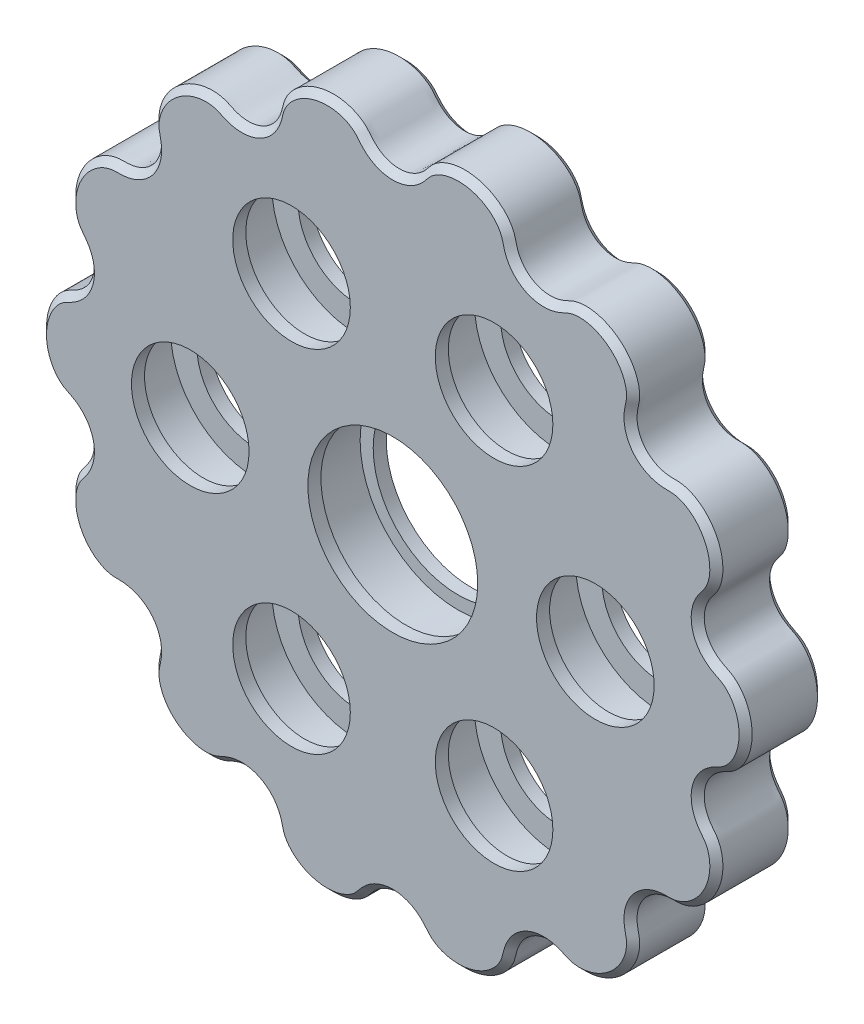
from build123d import *

# Parameters (mm, degrees)
LOBEBASE_DEPTH      = 3
LOBEBASE_DEPTH_BACK = 3
BOREREVOLVESKETCH_W = 6
BOREREVOLVESKETCH_H = 7.5
SKETCH1_R           = 6.5
CUT_EXTRUDE1_DEPTH  = 39.259605541
SKETCH2_R           = 7.5
SKETCH2_R_2         = 6.5
BOSS_EXTRUDE1_DEPTH = 1
BOSS_EXTRUDE2_START = -5
SKETCH2_2_R         = 7.5
SKETCH2_2_R_2       = 6.5
BOSS_EXTRUDE2_DEPTH = 1
SKETCH3_R           = 6.5
SKETCH3_R_2         = 4.5
BOSS_EXTRUDE3_DEPTH = 1
BOSS_EXTRUDE4_START = -5
SKETCH3_2_R         = 6.5
SKETCH3_2_R_2       = 4.5
BOSS_EXTRUDE4_DEPTH = 1
CHAMFER1_SIZE       = 0.5


with BuildPart() as part:
    # LobeBaseSketch → LobeBase (new, two sides: drawn at the far end of the back side and taken through both)
    with BuildSketch(Plane.XY.offset(-LOBEBASE_DEPTH_BACK)):
        with BuildLine():
            add(Edge.make_bspline(
                [(27, 0), (27, 0.121069856), (26.990222559, 0.362149228), (26.946659636, 0.718772486), (26.875703391, 1.064531007), (26.779762989, 1.394454994), (26.662084286, 1.704114682), (26.526623862, 1.989775884), (26.377887527, 2.248535855), (26.220731626, 2.47843636), (26.060121888, 2.678552425), (25.900837152, 2.849058104), (25.747089803, 2.991275915), (25.60200158, 3.107728779), (25.466797299, 3.20224233), (25.339394472, 3.280230369), (25.211573238, 3.349556807), (25.062548838, 3.423396592), (24.843299997, 3.530576201), (24.451170363, 3.751663149), (23.825065297, 4.28054647), (23.28812949, 5.315363587), (23.322901616, 6.480669309), (23.657528916, 7.228833523), (23.914899477, 7.598164652), (24.065932368, 7.78985865), (24.16816083, 7.921045261), (24.253244169, 8.038965778), (24.334192407, 8.164508589), (24.414999362, 8.308325295), (24.49519233, 8.47619712), (24.57200791, 8.671039415), (24.641538857, 8.893770781), (24.699416124, 9.143755079), (24.741258607, 9.419075666), (24.76299367, 9.716744622), (24.761095545, 10.032890547), (24.732764089, 10.362943161), (24.676054752, 10.701821383), (24.58996512, 11.044125807), (24.474480925, 11.384333503), (24.330583391, 11.716991422), (24.160219602, 12.036903864), (23.966237733, 12.339309072), (23.752289365, 12.620039975), (23.522701396, 12.875664235), (23.282320245, 13.103599098), (23.036330869, 13.302196873), (22.790052318, 13.470797274), (22.548709654, 13.609743082), (22.317178173, 13.720355473), (22.099687943, 13.804864724), (21.899460373, 13.866290069), (21.718213397, 13.908259054), (21.555390656, 13.934749882), (21.406766933, 13.949736663), (21.261524366, 13.95673807), (21.09522014, 13.958606154), (20.85118027, 13.960043137), (20.401957646, 13.989096923), (19.6083826, 14.193947523), (18.675629834, 14.893317813), (18.201351234, 15.958309051), (18.178223727, 16.77757106), (18.249859818, 17.22199581), (18.302762842, 17.46023685), (18.337947767, 17.62278717), (18.363441411, 17.765946162), (18.38190227, 17.914178451), (18.392307091, 18.078813649), (18.391721602, 18.264855362), (18.376391145, 18.473731235), (18.342396846, 18.704573608), (18.286078339, 18.954913684), (18.204319989, 19.221123734), (18.094748885, 19.498744687), (17.955868156, 19.782758757), (17.787137935, 20.06783333), (17.589010837, 20.348546798), (17.362926435, 20.619599536), (17.111268183, 20.876009365), (16.837286124, 21.113288993), (16.544988847, 21.327602066), (16.23900852, 21.515894166), (15.924443127, 21.675995251), (15.606680305, 21.806690265), (15.29120714, 21.907755008), (14.983410026, 21.97995463), (14.688367746, 22.025002084), (14.410639193, 22.045473273), (14.154043619, 22.04467385), (13.921424502, 22.02644858), (13.714374237, 21.994915417), (13.532866694, 21.95408805), (13.374674534, 21.907309322), (13.234266666, 21.856326528), (13.100369839, 21.79961619), (12.949724376, 21.729142576), (12.729228568, 21.624552322), (12.311887003, 21.455818487), (11.508019249, 21.296063191), (10.364192648, 21.521467792), (9.474800014, 22.275209969), (9.098498387, 23.003304885), (8.970211602, 23.434799484), (8.914506667, 23.672401006), (8.875679248, 23.834119951), (8.836533869, 23.974163024), (8.788850949, 24.115725567), (8.726792833, 24.268571238), (8.645544852, 24.435934996), (8.541104742, 24.617474018), (8.410318185, 24.810706236), (8.250958476, 25.011819166), (8.061792535, 25.216192516), (7.842617165, 25.418779231), (7.594260866, 25.614408976), (7.318550967, 25.798042992), (7.018247611, 25.964992962), (6.696947228, 26.111108695), (6.358958923, 26.232935544), (6.009157844, 26.327840742), (5.65282014, 26.394107113), (5.295444511, 26.430992544), (4.942565628, 26.438753829), (4.599564776, 26.418633847), (4.271482927, 26.372811358), (3.962841068, 26.304312807), (3.677471801, 26.216885113), (3.418364905, 26.114827113), (3.187527138, 26.002774211), (2.985852204, 25.885424158), (2.812988087, 25.767178016), (2.667169773, 25.651640658), (2.544940091, 25.540857475), (2.440557578, 25.434002874), (2.344526399, 25.324812969), (2.239376882, 25.19595582), (2.086097034, 25.006053711), (1.783296144, 24.672952061), (1.128351548, 24.180232366), (0, 23.887027132), (-1.128351548, 24.180232366), (-1.783296144, 24.672952061), (-2.086097034, 25.006053711), (-2.239376882, 25.19595582), (-2.344526399, 25.324812969), (-2.440557578, 25.434002874), (-2.544940091, 25.540857475), (-2.667169773, 25.651640658), (-2.812988087, 25.767178016), (-2.985852204, 25.885424158), (-3.187527138, 26.002774211), (-3.418364905, 26.114827113), (-3.677471801, 26.216885113), (-3.962841068, 26.304312807), (-4.271482927, 26.372811358), (-4.599564776, 26.418633847), (-4.942565628, 26.438753829), (-5.295444511, 26.430992544), (-5.65282014, 26.394107113), (-6.009157844, 26.327840742), (-6.358958923, 26.232935544), (-6.696947228, 26.111108695), (-7.018247611, 25.964992962), (-7.318550967, 25.798042992), (-7.594260866, 25.614408976), (-7.842617165, 25.418779231), (-8.061792535, 25.216192516), (-8.250958476, 25.011819166), (-8.410318185, 24.810706236), (-8.541104742, 24.617474018), (-8.645544852, 24.435934996), (-8.726792833, 24.268571238), (-8.788850949, 24.115725567), (-8.836533869, 23.974163024), (-8.875679248, 23.834119951), (-8.914506667, 23.672401006), (-8.970211602, 23.434799484), (-9.098498387, 23.003304885), (-9.474800014, 22.275209969), (-10.364192648, 21.521467792), (-11.508019249, 21.296063191), (-12.311887003, 21.455818487), (-12.729228568, 21.624552322), (-12.949724376, 21.729142576), (-13.100369839, 21.79961619), (-13.234266666, 21.856326528), (-13.374674534, 21.907309322), (-13.532866694, 21.95408805), (-13.714374237, 21.994915417), (-13.921424502, 22.02644858), (-14.154043619, 22.04467385), (-14.410639193, 22.045473273), (-14.688367746, 22.025002084), (-14.983410026, 21.97995463), (-15.29120714, 21.907755008), (-15.606680305, 21.806690265), (-15.924443127, 21.675995251), (-16.23900852, 21.515894166), (-16.544988847, 21.327602066), (-16.837286124, 21.113288993), (-17.111268183, 20.876009365), (-17.362926435, 20.619599536), (-17.589010837, 20.348546798), (-17.787137935, 20.06783333), (-17.955868156, 19.782758757), (-18.094748885, 19.498744687), (-18.204319989, 19.221123734), (-18.286078339, 18.954913684), (-18.342396846, 18.704573608), (-18.376391145, 18.473731235), (-18.391721602, 18.264855362), (-18.392307091, 18.078813649), (-18.38190227, 17.914178451), (-18.363441411, 17.765946162), (-18.337947767, 17.62278717), (-18.302762842, 17.46023685), (-18.249859818, 17.22199581), (-18.178223727, 16.77757106), (-18.201351234, 15.958309051), (-18.675629834, 14.893317813), (-19.6083826, 14.193947523), (-20.401957646, 13.989096923), (-20.85118027, 13.960043137), (-21.09522014, 13.958606154), (-21.261524366, 13.95673807), (-21.406766933, 13.949736663), (-21.555390656, 13.934749882), (-21.718213397, 13.908259054), (-21.899460373, 13.866290069), (-22.099687943, 13.804864724), (-22.317178173, 13.720355473), (-22.548709654, 13.609743082), (-22.790052318, 13.470797274), (-23.036330869, 13.302196873), (-23.282320245, 13.103599098), (-23.522701396, 12.875664235), (-23.752289365, 12.620039975), (-23.966237733, 12.339309072), (-24.160219602, 12.036903864), (-24.330583391, 11.716991422), (-24.474480925, 11.384333503), (-24.58996512, 11.044125807), (-24.676054752, 10.701821383), (-24.732764089, 10.362943161), (-24.761095545, 10.032890547), (-24.76299367, 9.716744622), (-24.741258607, 9.419075666), (-24.699416124, 9.143755079), (-24.641538857, 8.893770781), (-24.57200791, 8.671039415), (-24.49519233, 8.47619712), (-24.414999362, 8.308325295), (-24.334192407, 8.164508589), (-24.253244169, 8.038965778), (-24.16816083, 7.921045261), (-24.065932368, 7.78985865), (-23.914899477, 7.598164652), (-23.657528916, 7.228833523), (-23.322901616, 6.480669309), (-23.28812949, 5.315363587), (-23.825065297, 4.28054647), (-24.451170363, 3.751663149), (-24.843299997, 3.530576201), (-25.062548838, 3.423396592), (-25.211573238, 3.349556807), (-25.339394472, 3.280230369), (-25.466797299, 3.20224233), (-25.60200158, 3.107728779), (-25.747089803, 2.991275915), (-25.900837152, 2.849058104), (-26.060121888, 2.678552425), (-26.220731626, 2.47843636), (-26.377887527, 2.248535855), (-26.526623862, 1.989775884), (-26.662084286, 1.704114682), (-26.779762989, 1.394454994), (-26.875703391, 1.064531007), (-26.946659636, 0.718772486), (-26.990222559, 0.362149228), (-27.004910223, 0), (-26.990222559, -0.362149228), (-26.946659636, -0.718772486), (-26.875703391, -1.064531007), (-26.779762989, -1.394454994), (-26.662084286, -1.704114682), (-26.526623862, -1.989775884), (-26.377887527, -2.248535855), (-26.220731626, -2.47843636), (-26.060121888, -2.678552425), (-25.900837152, -2.849058104), (-25.747089803, -2.991275915), (-25.60200158, -3.107728779), (-25.466797299, -3.20224233), (-25.339394472, -3.280230369), (-25.211573238, -3.349556807), (-25.062548838, -3.423396592), (-24.843299997, -3.530576201), (-24.451170363, -3.751663149), (-23.825065297, -4.28054647), (-23.28812949, -5.315363587), (-23.322901616, -6.480669309), (-23.657528916, -7.228833523), (-23.914899477, -7.598164652), (-24.065932368, -7.78985865), (-24.16816083, -7.921045261), (-24.253244169, -8.038965778), (-24.334192407, -8.164508589), (-24.414999362, -8.308325295), (-24.49519233, -8.47619712), (-24.57200791, -8.671039415), (-24.641538857, -8.893770781), (-24.699416124, -9.143755079), (-24.741258607, -9.419075666), (-24.76299367, -9.716744622), (-24.761095545, -10.032890547), (-24.732764089, -10.362943161), (-24.676054752, -10.701821383), (-24.58996512, -11.044125807), (-24.474480925, -11.384333503), (-24.330583391, -11.716991422), (-24.160219602, -12.036903864), (-23.966237733, -12.339309072), (-23.752289365, -12.620039975), (-23.522701396, -12.875664235), (-23.282320245, -13.103599098), (-23.036330869, -13.302196873), (-22.790052318, -13.470797274), (-22.548709654, -13.609743082), (-22.317178173, -13.720355473), (-22.099687943, -13.804864724), (-21.899460373, -13.866290069), (-21.718213397, -13.908259054), (-21.555390656, -13.934749882), (-21.406766933, -13.949736663), (-21.261524366, -13.95673807), (-21.09522014, -13.958606154), (-20.85118027, -13.960043137), (-20.401957646, -13.989096923), (-19.6083826, -14.193947523), (-18.675629834, -14.893317813), (-18.201351234, -15.958309051), (-18.178223727, -16.77757106), (-18.249859818, -17.22199581), (-18.302762842, -17.46023685), (-18.337947767, -17.62278717), (-18.363441411, -17.765946162), (-18.38190227, -17.914178451), (-18.392307091, -18.078813649), (-18.391721602, -18.264855362), (-18.376391145, -18.473731235), (-18.342396846, -18.704573608), (-18.286078339, -18.954913684), (-18.204319989, -19.221123734), (-18.094748885, -19.498744687), (-17.955868156, -19.782758757), (-17.787137935, -20.06783333), (-17.589010837, -20.348546798), (-17.362926435, -20.619599536), (-17.111268183, -20.876009365), (-16.837286124, -21.113288993), (-16.544988847, -21.327602066), (-16.23900852, -21.515894166), (-15.924443127, -21.675995251), (-15.606680305, -21.806690265), (-15.29120714, -21.907755008), (-14.983410026, -21.97995463), (-14.688367746, -22.025002084), (-14.410639193, -22.045473273), (-14.154043619, -22.04467385), (-13.921424502, -22.02644858), (-13.714374237, -21.994915417), (-13.532866694, -21.95408805), (-13.374674534, -21.907309322), (-13.234266666, -21.856326528), (-13.100369839, -21.79961619), (-12.949724376, -21.729142576), (-12.729228568, -21.624552322), (-12.311887003, -21.455818487), (-11.508019249, -21.296063191), (-10.364192648, -21.521467792), (-9.474800014, -22.275209969), (-9.098498387, -23.003304885), (-8.970211602, -23.434799484), (-8.914506667, -23.672401006), (-8.875679248, -23.834119951), (-8.836533869, -23.974163024), (-8.788850949, -24.115725567), (-8.726792833, -24.268571238), (-8.645544852, -24.435934996), (-8.541104742, -24.617474018), (-8.410318185, -24.810706236), (-8.250958476, -25.011819166), (-8.061792535, -25.216192516), (-7.842617165, -25.418779231), (-7.594260866, -25.614408976), (-7.318550967, -25.798042992), (-7.018247611, -25.964992962), (-6.696947228, -26.111108695), (-6.358958923, -26.232935544), (-6.009157844, -26.327840742), (-5.65282014, -26.394107113), (-5.295444511, -26.430992544), (-4.942565628, -26.438753829), (-4.599564776, -26.418633847), (-4.271482927, -26.372811358), (-3.962841068, -26.304312807), (-3.677471801, -26.216885113), (-3.418364905, -26.114827113), (-3.187527138, -26.002774211), (-2.985852204, -25.885424158), (-2.812988087, -25.767178016), (-2.667169773, -25.651640658), (-2.544940091, -25.540857475), (-2.440557578, -25.434002874), (-2.344526399, -25.324812969), (-2.239376882, -25.19595582), (-2.086097034, -25.006053711), (-1.783296144, -24.672952061), (-1.128351548, -24.180232366), (0, -23.887027132), (1.128351548, -24.180232366), (1.783296144, -24.672952061), (2.086097034, -25.006053711), (2.239376882, -25.19595582), (2.344526399, -25.324812969), (2.440557578, -25.434002874), (2.544940091, -25.540857475), (2.667169773, -25.651640658), (2.812988087, -25.767178016), (2.985852204, -25.885424158), (3.187527138, -26.002774211), (3.418364905, -26.114827113), (3.677471801, -26.216885113), (3.962841068, -26.304312807), (4.271482927, -26.372811358), (4.599564776, -26.418633847), (4.942565628, -26.438753829), (5.295444511, -26.430992544), (5.65282014, -26.394107113), (6.009157844, -26.327840742), (6.358958923, -26.232935544), (6.696947228, -26.111108695), (7.018247611, -25.964992962), (7.318550967, -25.798042992), (7.594260866, -25.614408976), (7.842617165, -25.418779231), (8.061792535, -25.216192516), (8.250958476, -25.011819166), (8.410318185, -24.810706236), (8.541104742, -24.617474018), (8.645544852, -24.435934996), (8.726792833, -24.268571238), (8.788850949, -24.115725567), (8.836533869, -23.974163024), (8.875679248, -23.834119951), (8.914506667, -23.672401006), (8.970211602, -23.434799484), (9.098498387, -23.003304885), (9.474800014, -22.275209969), (10.364192648, -21.521467792), (11.508019249, -21.296063191), (12.311887003, -21.455818487), (12.729228568, -21.624552322), (12.949724376, -21.729142576), (13.100369839, -21.79961619), (13.234266666, -21.856326528), (13.374674534, -21.907309322), (13.532866694, -21.95408805), (13.714374237, -21.994915417), (13.921424502, -22.02644858), (14.154043619, -22.04467385), (14.410639193, -22.045473273), (14.688367746, -22.025002084), (14.983410026, -21.97995463), (15.29120714, -21.907755008), (15.606680305, -21.806690265), (15.924443127, -21.675995251), (16.23900852, -21.515894166), (16.544988847, -21.327602066), (16.837286124, -21.113288993), (17.111268183, -20.876009365), (17.362926435, -20.619599536), (17.589010837, -20.348546798), (17.787137935, -20.06783333), (17.955868156, -19.782758757), (18.094748885, -19.498744687), (18.204319989, -19.221123734), (18.286078339, -18.954913684), (18.342396846, -18.704573608), (18.376391145, -18.473731235), (18.391721602, -18.264855362), (18.392307091, -18.078813649), (18.38190227, -17.914178451), (18.363441411, -17.765946162), (18.337947767, -17.62278717), (18.302762842, -17.46023685), (18.249859818, -17.22199581), (18.178223727, -16.77757106), (18.201351234, -15.958309051), (18.675629834, -14.893317813), (19.6083826, -14.193947523), (20.401957646, -13.989096923), (20.85118027, -13.960043137), (21.09522014, -13.958606154), (21.261524366, -13.95673807), (21.406766933, -13.949736663), (21.555390656, -13.934749882), (21.718213397, -13.908259054), (21.899460373, -13.866290069), (22.099687943, -13.804864724), (22.317178173, -13.720355473), (22.548709654, -13.609743082), (22.790052318, -13.470797274), (23.036330869, -13.302196873), (23.282320245, -13.103599098), (23.522701396, -12.875664235), (23.752289365, -12.620039975), (23.966237733, -12.339309072), (24.160219602, -12.036903864), (24.330583391, -11.716991422), (24.474480925, -11.384333503), (24.58996512, -11.044125807), (24.676054752, -10.701821383), (24.732764089, -10.362943161), (24.761095545, -10.032890547), (24.76299367, -9.716744622), (24.741258607, -9.419075666), (24.699416124, -9.143755079), (24.641538857, -8.893770781), (24.57200791, -8.671039415), (24.49519233, -8.47619712), (24.414999362, -8.308325295), (24.334192407, -8.164508589), (24.253244169, -8.038965778), (24.16816083, -7.921045261), (24.065932368, -7.78985865), (23.914899477, -7.598164652), (23.657528916, -7.228833523), (23.322901616, -6.480669309), (23.28812949, -5.315363587), (23.825065297, -4.28054647), (24.451170363, -3.751663149), (24.843299997, -3.530576201), (25.062548838, -3.423396592), (25.211573238, -3.349556807), (25.339394472, -3.280230369), (25.466797299, -3.20224233), (25.60200158, -3.107728779), (25.747089803, -2.991275915), (25.900837152, -2.849058104), (26.060121888, -2.678552425), (26.220731626, -2.47843636), (26.377887527, -2.248535855), (26.526623862, -1.989775884), (26.662084286, -1.704114682), (26.779762989, -1.394454994), (26.875703391, -1.064531007), (26.946659636, -0.718772486), (26.990222559, -0.362149228), (27, -0.121069856), (27, 0)],
                knots=[0, 0, 0, 0, 0.001915682, 0.003814585, 0.00568012, 0.007496075, 0.009246828, 0.010917582, 0.012494651, 0.013965812, 0.015320796, 0.016551974, 0.017655442, 0.018632789, 0.019494234, 0.020264608, 0.020995763, 0.021794924, 0.022896741, 0.024858367, 0.028909602, 0.035714286, 0.042518969, 0.046570204, 0.048531831, 0.049633648, 0.050432808, 0.051163963, 0.051934338, 0.052795782, 0.053773129, 0.054876597, 0.056107776, 0.057462759, 0.058933921, 0.060510989, 0.062181744, 0.063932496, 0.065748451, 0.067613986, 0.06951289, 0.071428571, 0.073344253, 0.075243157, 0.077108692, 0.078924647, 0.080675399, 0.082346153, 0.083923222, 0.085394384, 0.086749367, 0.087980546, 0.089084014, 0.09006136, 0.090922805, 0.091693179, 0.092424334, 0.093223495, 0.094325312, 0.096286939, 0.100338173, 0.107142857, 0.113947541, 0.117998776, 0.119960402, 0.121062219, 0.12186138, 0.122592535, 0.123362909, 0.124224354, 0.1252017, 0.126305169, 0.127536347, 0.12889133, 0.130362492, 0.131939561, 0.133610315, 0.135361068, 0.137177023, 0.139042557, 0.140941461, 0.142857143, 0.144772824, 0.146671728, 0.148537263, 0.150353218, 0.152103971, 0.153774725, 0.155351794, 0.156822955, 0.158177938, 0.159409117, 0.160512585, 0.161489932, 0.162351376, 0.163121751, 0.163852906, 0.164652067, 0.165753883, 0.16771551, 0.171766745, 0.178571429, 0.185376112, 0.189427347, 0.191388974, 0.19249079, 0.193289951, 0.194021106, 0.194791481, 0.195652925, 0.196630272, 0.19773374, 0.198964919, 0.200319902, 0.201791064, 0.203368132, 0.205038887, 0.206789639, 0.208605594, 0.210471129, 0.212370033, 0.214285714, 0.216201396, 0.2181003, 0.219965835, 0.221781789, 0.223532542, 0.225203296, 0.226780365, 0.228251527, 0.22960651, 0.230837688, 0.231941157, 0.232918503, 0.233779948, 0.234550322, 0.235281477, 0.236080638, 0.237182455, 0.239144082, 0.243195316, 0.25, 0.256804684, 0.260855918, 0.262817545, 0.263919362, 0.264718523, 0.265449678, 0.266220052, 0.267081497, 0.268058843, 0.269162312, 0.27039349, 0.271748473, 0.273219635, 0.274796704, 0.276467458, 0.278218211, 0.280034165, 0.2818997, 0.283798604, 0.285714286, 0.287629967, 0.289528871, 0.291394406, 0.293210361, 0.294961113, 0.296631868, 0.298208936, 0.299680098, 0.301035081, 0.30226626, 0.303369728, 0.304347075, 0.305208519, 0.305978894, 0.306710049, 0.30750921, 0.308611026, 0.310572653, 0.314623888, 0.321428571, 0.328233255, 0.33228449, 0.334246117, 0.335347933, 0.336147094, 0.336878249, 0.337648624, 0.338510068, 0.339487415, 0.340590883, 0.341822062, 0.343177045, 0.344648206, 0.346225275, 0.347896029, 0.349646782, 0.351462737, 0.353328272, 0.355227176, 0.357142857, 0.359058539, 0.360957443, 0.362822977, 0.364638932, 0.366389685, 0.368060439, 0.369637508, 0.37110867, 0.372463653, 0.373694831, 0.3747983, 0.375775646, 0.376637091, 0.377407465, 0.37813862, 0.378937781, 0.380039598, 0.382001224, 0.386052459, 0.392857143, 0.399661827, 0.403713061, 0.405674688, 0.406776505, 0.407575666, 0.408306821, 0.409077195, 0.40993864, 0.410915986, 0.412019454, 0.413250633, 0.414605616, 0.416076778, 0.417653847, 0.419324601, 0.421075353, 0.422891308, 0.424756843, 0.426655747, 0.428571429, 0.43048711, 0.432386014, 0.434251549, 0.436067504, 0.437818256, 0.439489011, 0.441066079, 0.442537241, 0.443892224, 0.445123403, 0.446226871, 0.447204218, 0.448065662, 0.448836037, 0.449567192, 0.450366352, 0.451468169, 0.453429796, 0.457481031, 0.464285714, 0.471090398, 0.475141633, 0.477103259, 0.478205076, 0.479004237, 0.479735392, 0.480505766, 0.481367211, 0.482344558, 0.483448026, 0.484679204, 0.486034188, 0.487505349, 0.489082418, 0.490753172, 0.492503925, 0.49431988, 0.496185415, 0.498084318, 0.5, 0.501915682, 0.503814585, 0.50568012, 0.507496075, 0.509246828, 0.510917582, 0.512494651, 0.513965812, 0.515320796, 0.516551974, 0.517655442, 0.518632789, 0.519494234, 0.520264608, 0.520995763, 0.521794924, 0.522896741, 0.524858367, 0.528909602, 0.535714286, 0.542518969, 0.546570204, 0.548531831, 0.549633648, 0.550432808, 0.551163963, 0.551934338, 0.552795782, 0.553773129, 0.554876597, 0.556107776, 0.557462759, 0.558933921, 0.560510989, 0.562181744, 0.563932496, 0.565748451, 0.567613986, 0.56951289, 0.571428571, 0.573344253, 0.575243157, 0.577108692, 0.578924647, 0.580675399, 0.582346153, 0.583923222, 0.585394384, 0.586749367, 0.587980546, 0.589084014, 0.59006136, 0.590922805, 0.591693179, 0.592424334, 0.593223495, 0.594325312, 0.596286939, 0.600338173, 0.607142857, 0.613947541, 0.617998776, 0.619960402, 0.621062219, 0.62186138, 0.622592535, 0.623362909, 0.624224354, 0.6252017, 0.626305169, 0.627536347, 0.62889133, 0.630362492, 0.631939561, 0.633610315, 0.635361068, 0.637177023, 0.639042557, 0.640941461, 0.642857143, 0.644772824, 0.646671728, 0.648537263, 0.650353218, 0.652103971, 0.653774725, 0.655351794, 0.656822955, 0.658177938, 0.659409117, 0.660512585, 0.661489932, 0.662351376, 0.663121751, 0.663852906, 0.664652067, 0.665753883, 0.66771551, 0.671766745, 0.678571429, 0.685376112, 0.689427347, 0.691388974, 0.69249079, 0.693289951, 0.694021106, 0.694791481, 0.695652925, 0.696630272, 0.69773374, 0.698964919, 0.700319902, 0.701791064, 0.703368132, 0.705038887, 0.706789639, 0.708605594, 0.710471129, 0.712370033, 0.714285714, 0.716201396, 0.7181003, 0.719965835, 0.721781789, 0.723532542, 0.725203296, 0.726780365, 0.728251527, 0.72960651, 0.730837688, 0.731941157, 0.732918503, 0.733779948, 0.734550322, 0.735281477, 0.736080638, 0.737182455, 0.739144082, 0.743195316, 0.75, 0.756804684, 0.760855918, 0.762817545, 0.763919362, 0.764718523, 0.765449678, 0.766220052, 0.767081497, 0.768058843, 0.769162312, 0.77039349, 0.771748473, 0.773219635, 0.774796704, 0.776467458, 0.778218211, 0.780034165, 0.7818997, 0.783798604, 0.785714286, 0.787629967, 0.789528871, 0.791394406, 0.793210361, 0.794961113, 0.796631868, 0.798208936, 0.799680098, 0.801035081, 0.80226626, 0.803369728, 0.804347075, 0.805208519, 0.805978894, 0.806710049, 0.80750921, 0.808611026, 0.810572653, 0.814623888, 0.821428571, 0.828233255, 0.83228449, 0.834246117, 0.835347933, 0.836147094, 0.836878249, 0.837648624, 0.838510068, 0.839487415, 0.840590883, 0.841822062, 0.843177045, 0.844648206, 0.846225275, 0.847896029, 0.849646782, 0.851462737, 0.853328272, 0.855227176, 0.857142857, 0.859058539, 0.860957443, 0.862822977, 0.864638932, 0.866389685, 0.868060439, 0.869637508, 0.87110867, 0.872463653, 0.873694831, 0.8747983, 0.875775646, 0.876637091, 0.877407465, 0.87813862, 0.878937781, 0.880039598, 0.882001224, 0.886052459, 0.892857143, 0.899661827, 0.903713061, 0.905674688, 0.906776505, 0.907575666, 0.908306821, 0.909077195, 0.90993864, 0.910915986, 0.912019454, 0.913250633, 0.914605616, 0.916076778, 0.917653847, 0.919324601, 0.921075353, 0.922891308, 0.924756843, 0.926655747, 0.928571429, 0.93048711, 0.932386014, 0.934251549, 0.936067504, 0.937818256, 0.939489011, 0.941066079, 0.942537241, 0.943892224, 0.945123403, 0.946226871, 0.947204218, 0.948065662, 0.948836037, 0.949567192, 0.950366352, 0.951468169, 0.953429796, 0.957481031, 0.964285714, 0.971090398, 0.975141633, 0.977103259, 0.978205076, 0.979004237, 0.979735392, 0.980505766, 0.981367211, 0.982344558, 0.983448026, 0.984679204, 0.986034188, 0.987505349, 0.989082418, 0.990753172, 0.992503925, 0.99431988, 0.996185415, 0.998084318, 1, 1, 1, 1], degree=3))
        make_face()
    extrude(amount=LOBEBASE_DEPTH + LOBEBASE_DEPTH_BACK)

    # BoreRevolveSketch → BoreRevolveCut (revolve, cut)
    with BuildSketch(Plane(origin=(0, 0, 0), x_dir=(0, 0, -1), z_dir=(1, 0, 0)), mode=Mode.PRIVATE) as borerevolvecut_sk:
        with Locations((0, 3.75)):
            Rectangle(BOREREVOLVESKETCH_W, BOREREVOLVESKETCH_H)
    revolve(borerevolvecut_sk.sketch.rotate(Axis((0, 0, 0), (0, 0, -1)), 90), axis=Axis((0, 0, 0), (0, 0, -1)), mode=Mode.SUBTRACT)

    # Sketch1 → Cut-Extrude1 (cut, through all)
    with BuildSketch(Plane.XY.offset(3)):
        with Locations((15.5, 0)):
            Circle(SKETCH1_R)
        with Locations((7.75, -13.423393759)):
            Circle(SKETCH1_R)
        with Locations((-7.75, -13.423393759)):
            Circle(SKETCH1_R)
        with Locations((-15.5, 0)):
            Circle(SKETCH1_R)
        with Locations((-7.75, 13.423393759)):
            Circle(SKETCH1_R)
        with Locations((7.75, 13.423393759)):
            Circle(SKETCH1_R)
    extrude(amount=-CUT_EXTRUDE1_DEPTH, mode=Mode.SUBTRACT)

    # Sketch2 → Boss-Extrude1 (add)
    with BuildSketch(Plane.XY.offset(3)):
        Circle(SKETCH2_R)
        Circle(SKETCH2_R_2, mode=Mode.SUBTRACT)
    extrude(amount=-BOSS_EXTRUDE1_DEPTH)

    # Sketch2<2> → Boss-Extrude2 (add)
    with BuildSketch(Plane.XY.offset(3).offset(BOSS_EXTRUDE2_START)):
        Circle(SKETCH2_2_R)
        Circle(SKETCH2_2_R_2, mode=Mode.SUBTRACT)
    extrude(amount=-BOSS_EXTRUDE2_DEPTH)

    # Sketch3 → Boss-Extrude3 (add)
    # profile 1 of 6: a face of its own
    with BuildSketch(Plane.XY.offset(3)):
        with Locations((15.5, 0)):
            Circle(SKETCH3_R)
        with Locations((15.5, 0)):
            Circle(SKETCH3_R_2, mode=Mode.SUBTRACT)
    # profile 2 of 6: a face of its own
    with BuildSketch(Plane.XY.offset(3)):
        with Locations((7.75, -13.423393759)):
            Circle(SKETCH3_R)
        with Locations((7.75, -13.423393759)):
            Circle(SKETCH3_R_2, mode=Mode.SUBTRACT)
    # profile 3 of 6: a face of its own
    with BuildSketch(Plane.XY.offset(3)):
        with Locations((-7.75, -13.423393759)):
            Circle(SKETCH3_R)
        with Locations((-7.75, -13.423393759)):
            Circle(SKETCH3_R_2, mode=Mode.SUBTRACT)
    # profile 4 of 6: a face of its own
    with BuildSketch(Plane.XY.offset(3)):
        with Locations((-15.5, 0)):
            Circle(SKETCH3_R)
        with Locations((-15.5, 0)):
            Circle(SKETCH3_R_2, mode=Mode.SUBTRACT)
    # profile 5 of 6: a face of its own
    with BuildSketch(Plane.XY.offset(3)):
        with Locations((-7.75, 13.423393759)):
            Circle(SKETCH3_R)
        with Locations((-7.75, 13.423393759)):
            Circle(SKETCH3_R_2, mode=Mode.SUBTRACT)
    # profile 6 of 6: a face of its own
    with BuildSketch(Plane.XY.offset(3)):
        with Locations((7.75, 13.423393759)):
            Circle(SKETCH3_R)
        with Locations((7.75, 13.423393759)):
            Circle(SKETCH3_R_2, mode=Mode.SUBTRACT)
    extrude(amount=-BOSS_EXTRUDE3_DEPTH)

    # Sketch3<2> → Boss-Extrude4 (add)
    # profile 1 of 6: a face of its own
    with BuildSketch(Plane.XY.offset(3).offset(BOSS_EXTRUDE4_START)):
        with Locations((15.5, 0)):
            Circle(SKETCH3_2_R)
        with Locations((15.5, 0)):
            Circle(SKETCH3_2_R_2, mode=Mode.SUBTRACT)
    # profile 2 of 6: a face of its own
    with BuildSketch(Plane.XY.offset(3).offset(BOSS_EXTRUDE4_START)):
        with Locations((7.75, -13.423393759)):
            Circle(SKETCH3_2_R)
        with Locations((7.75, -13.423393759)):
            Circle(SKETCH3_2_R_2, mode=Mode.SUBTRACT)
    # profile 3 of 6: a face of its own
    with BuildSketch(Plane.XY.offset(3).offset(BOSS_EXTRUDE4_START)):
        with Locations((-7.75, -13.423393759)):
            Circle(SKETCH3_2_R)
        with Locations((-7.75, -13.423393759)):
            Circle(SKETCH3_2_R_2, mode=Mode.SUBTRACT)
    # profile 4 of 6: a face of its own
    with BuildSketch(Plane.XY.offset(3).offset(BOSS_EXTRUDE4_START)):
        with Locations((-15.5, 0)):
            Circle(SKETCH3_2_R)
        with Locations((-15.5, 0)):
            Circle(SKETCH3_2_R_2, mode=Mode.SUBTRACT)
    # profile 5 of 6: a face of its own
    with BuildSketch(Plane.XY.offset(3).offset(BOSS_EXTRUDE4_START)):
        with Locations((-7.75, 13.423393759)):
            Circle(SKETCH3_2_R)
        with Locations((-7.75, 13.423393759)):
            Circle(SKETCH3_2_R_2, mode=Mode.SUBTRACT)
    # profile 6 of 6: a face of its own
    with BuildSketch(Plane.XY.offset(3).offset(BOSS_EXTRUDE4_START)):
        with Locations((7.75, 13.423393759)):
            Circle(SKETCH3_2_R)
        with Locations((7.75, 13.423393759)):
            Circle(SKETCH3_2_R_2, mode=Mode.SUBTRACT)
    extrude(amount=-BOSS_EXTRUDE4_DEPTH)

    # Chamfer1
    chamfer1_edges = [part.edges().sort_by_distance(p)[0] for p in [
        (-27, 0, 3),
        (-27, 0, -3),
    ]]
    chamfer(chamfer1_edges, length=CHAMFER1_SIZE)


solid = part.part
